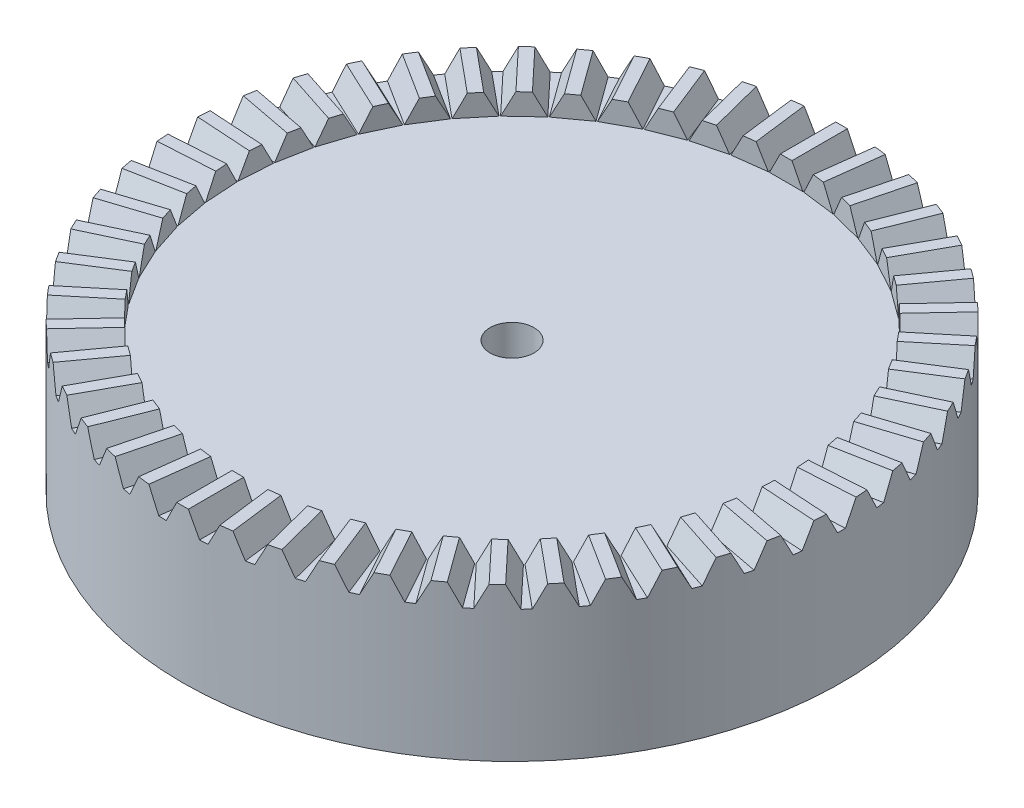
from build123d import *

# Parameters (mm, degrees)
SKETCH3_R           = 30
BOSS_EXTRUDE3_DEPTH = 12
CUT_EXTRUDE1_REACH  = 46.091
SKETCH6_R           = 2
BOSS_EXTRUDE5_DEPTH = 3
CUT_EXTRUDE4_REACH  = 66.385
CIRPATTERN2_COUNT   = 50


with BuildPart() as part:
    # Sketch3 → Boss-Extrude3 (new body)
    with BuildSketch(Plane(origin=(0, 0, 0), x_dir=(1, 0, 0), z_dir=(0, 1, 0))):
        Circle(SKETCH3_R)
    extrude(amount=BOSS_EXTRUDE3_DEPTH)

    # Sketch6 → Cut-Extrude1 (cut, up to next)
    with BuildSketch(Plane(origin=(0, 12, 0), x_dir=(1, 0, 0), z_dir=(0, 1, 0)), mode=Mode.PRIVATE) as cut_extrude1_sk1:
        Circle(SKETCH6_R)
    cut_extrude1_tool1 = extrude(cut_extrude1_sk1.sketch, amount=-CUT_EXTRUDE1_REACH, mode=Mode.PRIVATE) & part.part
    add(cut_extrude1_tool1.solids().sort_by_distance((0, 12, 0))[0], mode=Mode.SUBTRACT)

    # Sketch5 → Boss-Extrude5 (add)
    with BuildSketch(Plane(origin=(0, 12, 0), x_dir=(1, 0, 0), z_dir=(0, 1, 0))):
        with BuildLine():
            Line((-1.570078687, 29.958886043), (-1.570078687, 24.958886043))
            Line((-1.570078687, 24.958886043), (1.570078687, 24.958886043))
            Line((1.570078687, 24.958886043), (1.570078687, 29.958886043))
            ThreePointArc((1.570078687, 29.958886043), (0, 30), (-1.570078687, 29.958886043))
        make_face()
    boss_extrude5 = extrude(amount=BOSS_EXTRUDE5_DEPTH)

    # Sketch14 → Cut-Extrude4 (cut, up to next)
    with BuildSketch(Plane.XY.offset(-24.958886043), mode=Mode.PRIVATE) as cut_extrude4_sk1:
        Polygon((-1.570078687, 15), (-1.570078687, 12), (-1.520078687, 12), (-0.532027541, 13.95), (0.532027541, 13.95), (1.520078687, 12), (1.570078687, 12), (1.570078687, 15), align=None)
    cut_extrude4_tool1 = extrude(cut_extrude4_sk1.sketch, amount=-CUT_EXTRUDE4_REACH, mode=Mode.PRIVATE) & part.part
    cut_extrude4 = cut_extrude4_tool1.solids().sort_by_distance((0, 14.003246, -24.958886))[0]
    add(cut_extrude4, mode=Mode.SUBTRACT)

    # CirPattern2: Boss-Extrude5, Cut-Extrude4 ×50 about axis
    cirpattern2_axis = Axis((0, -0.001, 0), (0, 1, 0))
    add([boss_extrude5.rotate(cirpattern2_axis, i * 360 / CIRPATTERN2_COUNT) for i in range(1, CIRPATTERN2_COUNT)])
    add([cut_extrude4.rotate(cirpattern2_axis, i * 360 / CIRPATTERN2_COUNT) for i in range(1, CIRPATTERN2_COUNT)], mode=Mode.SUBTRACT)


solid = part.part
